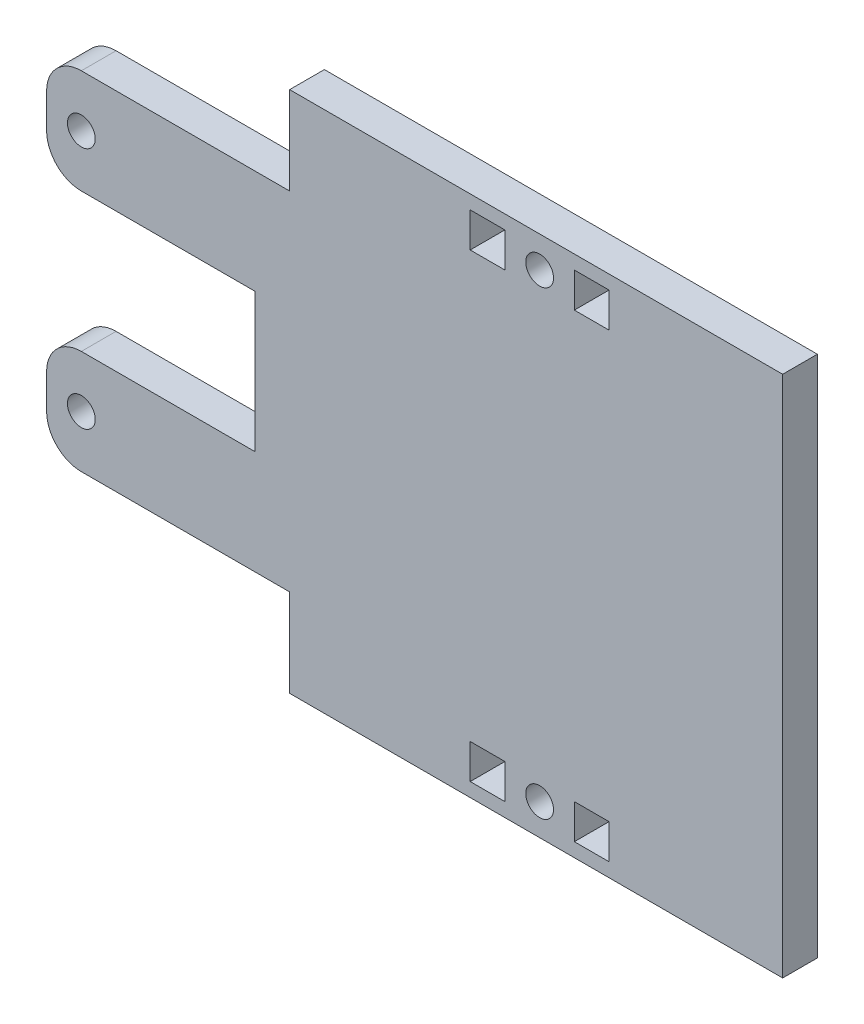
from build123d import *

# Parameters (mm, degrees)
ESQUISSE1_R        = 2
ESQUISSE1_W        = 5
ESQUISSE1_H        = 5
BOSS_EXTRU_1_DEPTH = 5
CONG_1_R           = 5


with BuildPart() as part:
    # Esquisse1 → Boss.-Extru.1 (new body)
    with BuildSketch(Plane.XY):
        Polygon((0, 37.65), (71, 37.65), (71, -37.65), (0, -37.65), (0, -25), (-35, -25), (-35, -10), (-5, -10), (-5, 10), (-35, 10), (-35, 25), (0, 25), align=None)
        with Locations((-30, 17.5)):
            Circle(ESQUISSE1_R, mode=Mode.SUBTRACT)
        with Locations((-30, -17.5)):
            Circle(ESQUISSE1_R, mode=Mode.SUBTRACT)
        with Locations((36, 33.15)):
            Circle(ESQUISSE1_R, mode=Mode.SUBTRACT)
        with Locations((36, -33.15)):
            Circle(ESQUISSE1_R, mode=Mode.SUBTRACT)
        with Locations((28.5, 33.15)):
            Rectangle(ESQUISSE1_W, ESQUISSE1_H, mode=Mode.SUBTRACT)
        with Locations((43.5, 33.15)):
            Rectangle(ESQUISSE1_W, ESQUISSE1_H, mode=Mode.SUBTRACT)
        with Locations((28.5, -33.15)):
            Rectangle(ESQUISSE1_W, ESQUISSE1_H, mode=Mode.SUBTRACT)
        with Locations((43.5, -33.15)):
            Rectangle(ESQUISSE1_W, ESQUISSE1_H, mode=Mode.SUBTRACT)
    extrude(amount=BOSS_EXTRU_1_DEPTH)

    # Congé1
    cong_1_edges = [part.edges().sort_by_distance(p)[0] for p in [
        (-35, -25, 2.5),
        (-35, -10, 2.5),
        (-35, 10, 2.5),
        (-35, 25, 2.5),
    ]]
    fillet(cong_1_edges, radius=CONG_1_R)


solid = part.part
